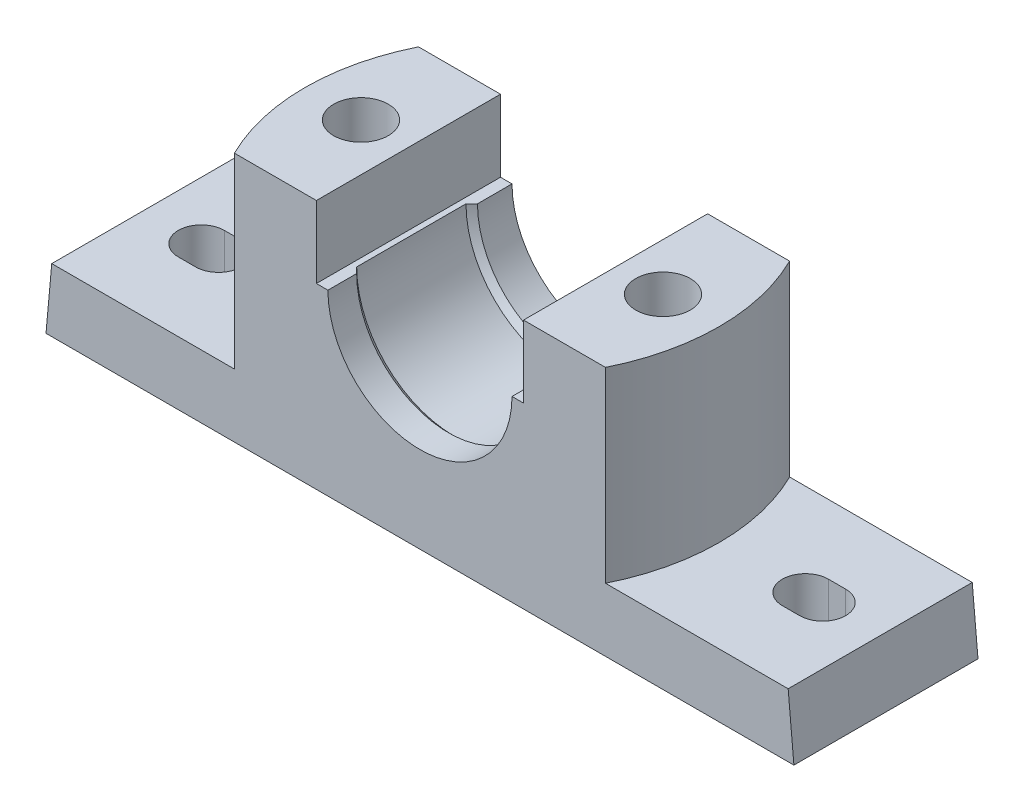
from build123d import *

# Parameters (mm, degrees)
SKETCH1_W           = 260
SKETCH1_H           = 64
BOSS_EXTRUDE1_DEPTH = 11
CUT_EXTRUDE1_DEPTH  = 22
BOSS_EXTRUDE2_DEPTH = 65
CUT_EXTRUDE2_DEPTH  = 164.621514478
CUT_EXTRUDE3_DEPTH  = 96
SKETCH6_R           = 9.5
CUT_EXTRUDE4_DEPTH  = 96
SKETCH7_R           = 15
CUT_EXTRUDE5_DEPTH  = 12
CUT_EXTRUDE7_START  = -12
CUT_EXTRUDE7_DEPTH  = 38
CHAMFER1_SIZE       = 2
CHAMFER2_SIZE       = 2
SKETCH13_W          = 114
SKETCH13_H          = 40
CUT_EXTRUDE8_DEPTH  = 2


with BuildPart() as part:
    # Sketch1 → Boss-Extrude1 (new, symmetric)
    with BuildSketch(Plane(origin=(0, 0, 0), x_dir=(1, 0, 0), z_dir=(0, 1, 0))):
        Rectangle(SKETCH1_W, SKETCH1_H)
    extrude(amount=BOSS_EXTRUDE1_DEPTH, both=True)

    # Sketch2 → Cut-Extrude1 (cut)
    with BuildSketch(Plane(origin=(0, 11, 0), x_dir=(1, 0, 0), z_dir=(0, 1, 0))):
        with BuildLine():
            Line((-108, 8), (-102, 8))
            ThreePointArc((-102, 8), (-94, 0), (-102, -8))
            Line((-102, -8), (-108, -8))
            ThreePointArc((-108, -8), (-116, 0), (-108, 8))
        make_face()
        with BuildLine():
            Line((108, 8), (102, 8))
            ThreePointArc((102, 8), (94, 0), (102, -8))
            Line((102, -8), (108, -8))
            ThreePointArc((108, -8), (116, 0), (108, 8))
        make_face()
    extrude(amount=-CUT_EXTRUDE1_DEPTH, mode=Mode.SUBTRACT)

    # Sketch3 → Boss-Extrude2 (add)
    with BuildSketch(Plane(origin=(0, 11, 0), x_dir=(1, 0, 0), z_dir=(0, 1, 0))):
        with BuildLine():
            Line((-64.498061986, 32), (64.498061986, 32))
            ThreePointArc((64.498061986, 32), (72, 0), (64.498061986, -32))
            Line((64.498061986, -32), (-64.498061986, -32))
            ThreePointArc((-64.498061986, -32), (-72, 0), (-64.498061986, 32))
        make_face()
    extrude(amount=BOSS_EXTRUDE2_DEPTH)

    # Sketch4 → Cut-Extrude2 (cut, through all)
    with BuildSketch(Plane.XY.offset(32)):
        Polygon((-130, 11), (-128, 11), (-130, -11), align=None)
        Polygon((130, -11), (128, 11), (130, 11), align=None)
    extrude(amount=-CUT_EXTRUDE2_DEPTH, mode=Mode.SUBTRACT)

    # Sketch5 → Cut-Extrude3 (cut)
    with BuildSketch(Plane.XY.offset(32)):
        with BuildLine():
            Line((-19.974984355, 76), (-36, 76))
            Line((-36, 76), (-36, 51))
            Line((-36, 51), (-32, 51))
            ThreePointArc((-32, 51), (0, 19), (32, 51))
            Line((32, 51), (36, 51))
            Line((36, 51), (36, 76))
            Line((36, 76), (-19.974984355, 76))
        make_face()
    extrude(amount=-CUT_EXTRUDE3_DEPTH, mode=Mode.SUBTRACT)

    # Sketch6 → Cut-Extrude4 (cut)
    with BuildSketch(Plane(origin=(0, 76, 0), x_dir=(1, 0, 0), z_dir=(0, 1, 0))):
        with Locations(Location((-52.5, 0, 0), (0, 0, 270))):
            Circle(SKETCH6_R)
        with Locations(Location((52.5, 0, 0), (0, 0, 90))):
            Circle(SKETCH6_R)
    extrude(amount=-CUT_EXTRUDE4_DEPTH, mode=Mode.SUBTRACT)

    # Sketch7 → Cut-Extrude5 (cut)
    with BuildSketch(Plane.XZ.offset(11)):
        with Locations(Location((-52.5, 0, 0), (0, 0, 270))):
            Circle(SKETCH7_R)
        with Locations(Location((52.5, 0, 0), (0, 0, 270))):
            Circle(SKETCH7_R)
    extrude(amount=-CUT_EXTRUDE5_DEPTH, mode=Mode.SUBTRACT)

    # Sketch10 → Cut-Extrude7 (cut)
    with BuildSketch(Plane.XY.offset(32).offset(CUT_EXTRUDE7_START)):
        with BuildLine():
            Line((-34, 51), (34, 51))
            ThreePointArc((34, 51), (0, 17), (-34, 51))
        make_face()
    extrude(amount=-CUT_EXTRUDE7_DEPTH, mode=Mode.SUBTRACT)

    # Chamfer1
    chamfer1_edges = [part.edges().sort_by_distance(p)[0] for p in [
        (0, 19, 20),
    ]]
    chamfer(chamfer1_edges, length=CHAMFER1_SIZE - 0.0001)  # a hair under: the kernel refuses the full size

    # Chamfer2
    chamfer2_edges = [part.edges().sort_by_distance(p)[0] for p in [
        (0, 19, -18),
    ]]
    chamfer(chamfer2_edges, length=CHAMFER2_SIZE - 0.0001)  # a hair under: the kernel refuses the full size

    # Sketch13 → Cut-Extrude8 (cut)
    with BuildSketch(Plane.XZ.offset(11)):
        with Locations((-61, -2.5e-06)):
            Rectangle(SKETCH13_W, SKETCH13_H)
        with Locations((61, -2.5e-06)):
            Rectangle(SKETCH13_W, SKETCH13_H)
    extrude(amount=-CUT_EXTRUDE8_DEPTH, mode=Mode.SUBTRACT)


solid = part.part
